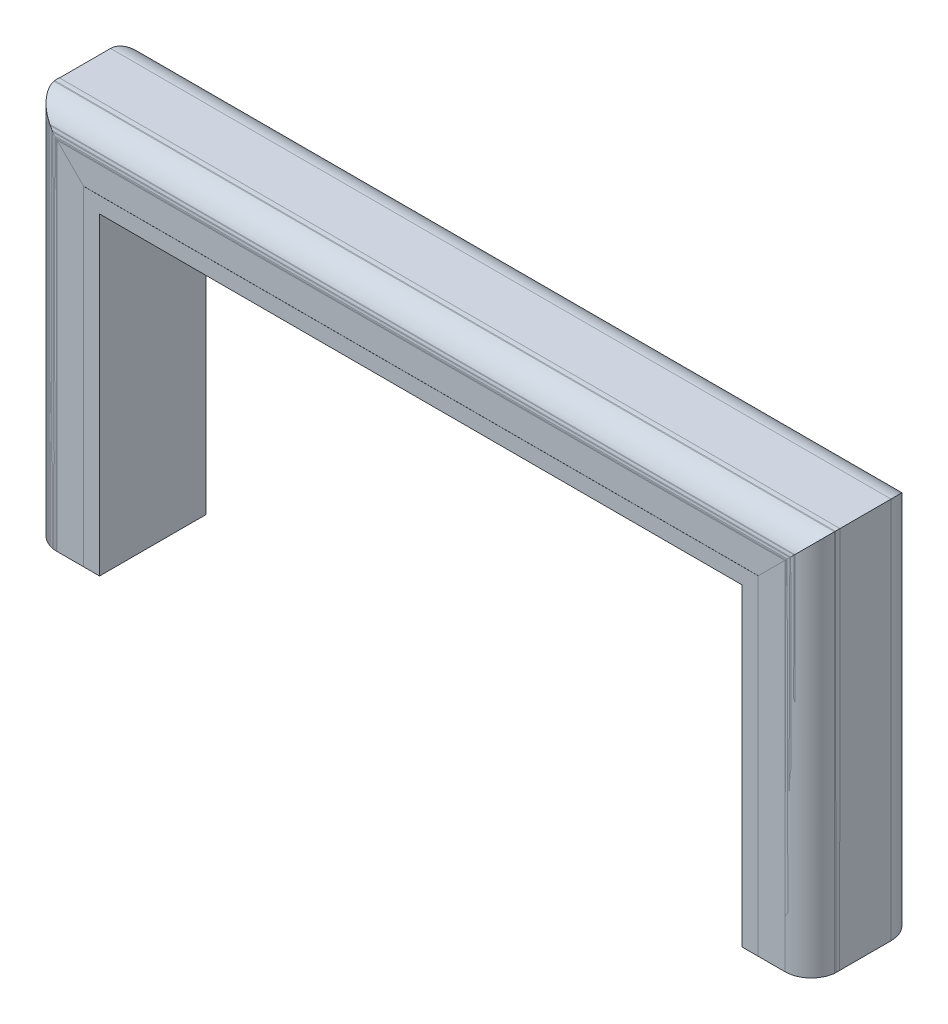
from build123d import *

# Parameters (mm, degrees)
PLYWOOD_DEPTH = 127
SKETCH2_R     = 31.75
SKETCH2_R_2   = 31.623


with BuildPart() as part:
    # Sketch1 → Plywood (new body)
    with BuildSketch(Plane.XY):
        Polygon((-402.95, 0), (-402.95, 393.7), (402.95, 393.7), (402.95, 0), (383.9, 0), (383.9, 374.65), (-383.9, 374.65), (-383.9, 0), align=None)
    extrude(amount=PLYWOOD_DEPTH)


with BuildPart() as body_2:
    # Sweep1: sweep along a path in Sketch3
    with BuildLine(Plane.XY.offset(95.25)) as sweep1_path:
        Line((-434.7, 0), (-434.7, 425.45))
        Line((-434.7, 425.45), (434.7, 425.45))
        Line((434.7, 425.45), (434.7, 0))
    # Sketch2 → Sweep1 (sweep)
    with BuildSketch(Plane.XZ):
        with Locations((-434.7, 95.25)):
            Circle(SKETCH2_R)
        with Locations((-434.573, 31.623)):
            Circle(SKETCH2_R_2)
    sweep(path=sweep1_path.line, transition=Transition.RIGHT)


with BuildPart() as body_3:
    # Sweep2: sweep along a path in Sketch4
    with BuildLine(Plane.XY.offset(31.623)) as sweep2_path:
        Line((-434.573, 0), (-434.573, 425.45))
        Line((-434.573, 425.45), (434.7, 425.45))
        Line((434.7, 425.45), (434.7, 0))
    # Sketch6 → Sweep2 (sweep)
    with BuildSketch(Plane.XZ):
        with BuildLine():
            Line((-434.573, 0), (-402.95, 0))
            Line((-402.95, 0), (-402.95, 127))
            Line((-402.95, 127), (-434.7, 127))
            ThreePointArc((-434.7, 127), (-455.685790865, 119.075597196), (-466.196, 99.258052395))
            Line((-466.196, 99.258052395), (-466.196, 91.241947605))
            Line((-466.196, 91.241947605), (-466.196, 31.623))
            ThreePointArc((-466.196, 31.623), (-456.933837741, 9.262162259), (-434.573, 0))
        make_face()
    sweep(path=sweep2_path.line, transition=Transition.RIGHT)


solid = Compound([part.part, body_2.part, body_3.part])
